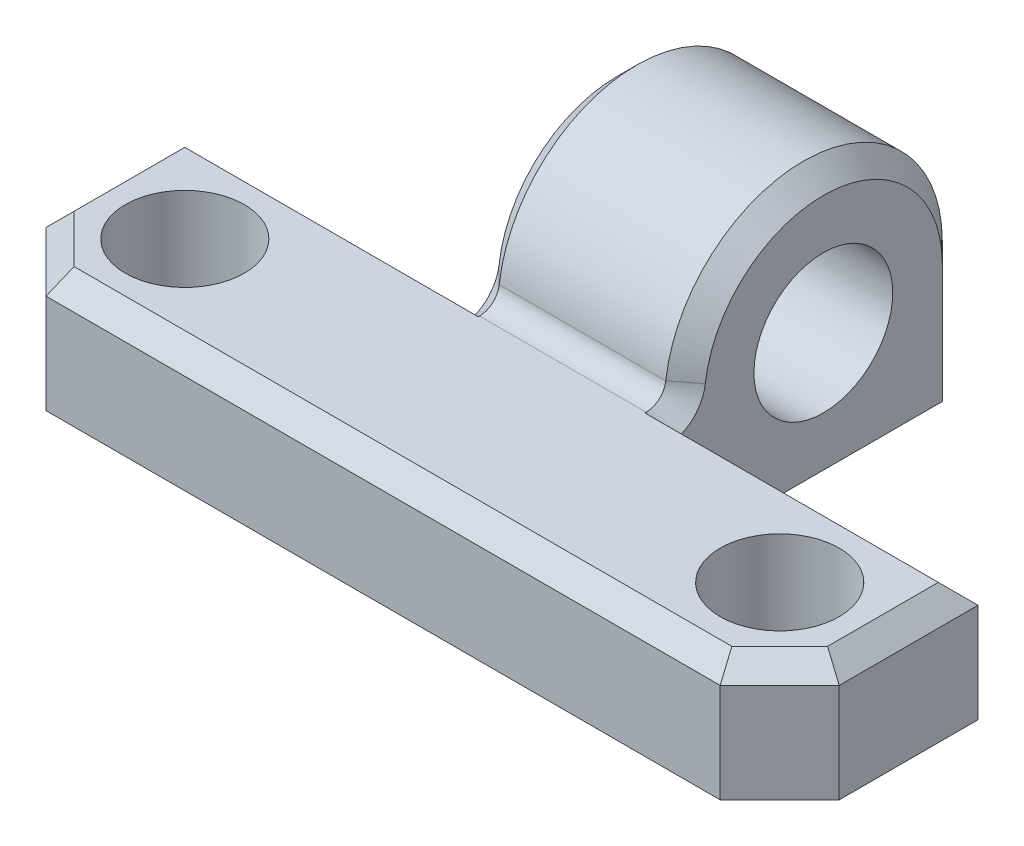
from build123d import *

# Parameters (mm, degrees)
SKIZZE1_W                       = 20
SKIZZE1_H                       = 12
AUFSATZ_LINEAR_AUSTRAGEN1_DEPTH = 3
SCHNITT_LINEAR_AUSTRAGEN1_REACH = 14.042
SKIZZE2_R                       = 1.5
AUFSATZ_LINEAR_AUSTRAGEN2_DEPTH = 20
FASE1_SIZE                      = 1.5
SKIZZE4_R                       = 1.75
SCHNITT_LINEAR_AUSTRAGEN2_DEPTH = 22.868927729
SKIZZE5_W                       = 7.4
SKIZZE5_H                       = 7
SCHNITT_LINEAR_AUSTRAGEN5_DEPTH = 14.351029923
FASE2_SIZE                      = 0.5
VERRUNDUNG1_R                   = 0.5
FASE3_SIZE                      = 0.5


with BuildPart() as part:
    # Skizze1 → Aufsatz-Linear austragen1 (new body)
    with BuildSketch(Plane(origin=(0, 0, 0), x_dir=(1, 0, 0), z_dir=(0, 1, 0))):
        Rectangle(SKIZZE1_W, SKIZZE1_H)
    extrude(amount=AUFSATZ_LINEAR_AUSTRAGEN1_DEPTH)

    # Skizze2 → Schnitt-Linear austragen1 (cut, up to next)
    with BuildSketch(Plane(origin=(0, 3, 0), x_dir=(1, 0, 0), z_dir=(0, 1, 0)), mode=Mode.PRIVATE) as schnitt_linear_austragen1_sk1:
        with Locations(Location((-7.5, -3.5, 0), (0, 0, 270))):
            Circle(SKIZZE2_R)
    schnitt_linear_austragen1_tool1 = extrude(schnitt_linear_austragen1_sk1.sketch, amount=-SCHNITT_LINEAR_AUSTRAGEN1_REACH, mode=Mode.PRIVATE) & part.part
    # Skizze2 → Schnitt-Linear austragen1 (cut, up to next)
    with BuildSketch(Plane(origin=(0, 3, 0), x_dir=(1, 0, 0), z_dir=(0, 1, 0)), mode=Mode.PRIVATE) as schnitt_linear_austragen1_sk2:
        with Locations(Location((7.5, -3.5, 0), (0, 0, 270))):
            Circle(SKIZZE2_R)
    schnitt_linear_austragen1_tool2 = extrude(schnitt_linear_austragen1_sk2.sketch, amount=-SCHNITT_LINEAR_AUSTRAGEN1_REACH, mode=Mode.PRIVATE) & part.part
    add(schnitt_linear_austragen1_tool1.solids().sort_by_distance((-7.5, 3, 3.5))[0], mode=Mode.SUBTRACT)
    add(schnitt_linear_austragen1_tool2.solids().sort_by_distance((7.5, 3, 3.5))[0], mode=Mode.SUBTRACT)

    # Skizze3 → Aufsatz-Linear austragen2 (add)
    with BuildSketch(Plane.ZY.offset(10)):
        with BuildLine():
            Line((-6, 3), (1, 3))
            ThreePointArc((1, 3), (-2.5, 6.5), (-6, 3))
        make_face()
    extrude(amount=-AUFSATZ_LINEAR_AUSTRAGEN2_DEPTH)

    # Fase1
    fase1_edges = [part.edges().sort_by_distance(p)[0] for p in [
        (10, 1.5, 6),
        (-10, 1.5, 6),
    ]]
    chamfer(fase1_edges, length=FASE1_SIZE)

    # Skizze4 → Schnitt-Linear austragen2 (cut, through all)
    with BuildSketch(Plane.ZY.offset(10)):
        with Locations((-2.5, 3)):
            Circle(SKIZZE4_R)
    extrude(amount=-SCHNITT_LINEAR_AUSTRAGEN2_DEPTH, mode=Mode.SUBTRACT)

    # Skizze5 → Schnitt-Linear austragen5 (cut, through all)
    with BuildSketch(Plane(origin=(0, 0, 0), x_dir=(1, 0, 0), z_dir=(0, 1, 0))):
        with Locations((-6.3, 2.5)):
            Rectangle(SKIZZE5_W, SKIZZE5_H)
        with Locations((6.3, 2.5)):
            Rectangle(SKIZZE5_W, SKIZZE5_H)
    extrude(amount=SCHNITT_LINEAR_AUSTRAGEN5_DEPTH, mode=Mode.SUBTRACT)

    # Fase2
    fase2_edges = [part.edges().sort_by_distance(p)[0] for p in [
        (-10, 3, 2.75),
        (6.3, 3, 1),
        (10, 3, 2.75),
        (0, 3, 6),
        (-9.25, 3, 5.25),
        (9.25, 3, 5.25),
        (-6.3, 3, 1),
    ]]
    chamfer(fase2_edges, length=FASE2_SIZE)

    # Verrundung1
    verrundung1_edges = [part.edges().sort_by_distance(p)[0] for p in [
        (0, 3, 1),
    ]]
    fillet(verrundung1_edges, radius=VERRUNDUNG1_R)

    # Fase3
    # the kernel refuses this chamfer: 0.5 mm, written as the material it takes off along each edge
    with BuildSketch(Plane(origin=(2.6, 3, 1.468626967), x_dir=(-0.9996219169112968, 0.027495876610586487, 0), z_dir=(0, 0, 1))) as fase3_piece_1_section:
        Polygon((FASE3_SIZE * 0.999621916911, FASE3_SIZE * 0.0274958766106), (-FASE3_SIZE * 0.0274958766106, FASE3_SIZE * 0.999621916911), (0, 0), align=None)
    fase3_piece_1 = extrude(amount=1.317214527, mode=Mode.PRIVATE)
    fase3_piece_1 = split(fase3_piece_1, bisect_by=Plane(origin=(2.355172989, 2.984397258, 1.484397258), z_dir=(0, 0.7071067811865476, -0.7071067811865476)), keep=Keep.TOP, mode=Mode.PRIVATE)
    add(fase3_piece_1, mode=Mode.SUBTRACT)
    with BuildSketch(Plane(origin=(-2.6, 3, 1.468626967), x_dir=(0.9996219169112968, 0.027495876610586487, 0), z_dir=(0, 0, 1))) as fase3_piece_2_section:
        Polygon((FASE3_SIZE * 0.999621916911, -FASE3_SIZE * 0.0274958766106), (-FASE3_SIZE * 0.0274958766106, -FASE3_SIZE * 0.999621916911), (0, 0), align=None)
    fase3_piece_2 = extrude(amount=1.317214527, mode=Mode.PRIVATE)
    fase3_piece_2 = split(fase3_piece_2, bisect_by=Plane(origin=(-2.355172989, 2.984397258, 1.484397258), z_dir=(0, 0.7071067811865476, -0.7071067811865476)), keep=Keep.TOP, mode=Mode.PRIVATE)
    add(fase3_piece_2, mode=Mode.SUBTRACT)
    with BuildSketch(Plane(origin=(2.6, 3, -2.5), x_dir=(0, 0.125, 0.9921567416492215), z_dir=(0, -0.9921567416492215, 0.125))) as fase3_piece_3:
        Polygon((3.5 - FASE3_SIZE, 0), (3.5, FASE3_SIZE), (3.5, 0), align=None)
    revolve(axis=Axis((2.6, 3, -2.5), (-1, 0, 0)), revolution_arc=172.819244219, mode=Mode.SUBTRACT)
    with BuildSketch(Plane(origin=(-2.6, 3.5, 1.468626967), x_dir=(0, -1, 0), z_dir=(0, 0, 1))) as fase3_piece_4_section:
        Polygon((0.5, FASE3_SIZE), (0.5 + FASE3_SIZE, 0), (0.5, 0), align=None)
    fase3_piece_4 = revolve(axis=Axis((-2.6, 3.5, 1.468626967), (1, 0, 0)), revolution_arc=82.819244219, mode=Mode.PRIVATE)
    fase3_piece_4 = split(fase3_piece_4, bisect_by=Plane(origin=(-2.375928001, 2.853387765, 1.353387765), z_dir=(0, 0.7071067811865476, -0.7071067811865476)), keep=Keep.TOP, mode=Mode.PRIVATE)
    add(fase3_piece_4, mode=Mode.SUBTRACT)
    with BuildSketch(Plane(origin=(2.6, 3.5, 1.468626967), x_dir=(0, -1, 0), z_dir=(0, 0, 1))) as fase3_piece_5_section:
        Polygon((0.5 + FASE3_SIZE, 0), (0.5, -FASE3_SIZE), (0.5, 0), align=None)
    fase3_piece_5 = revolve(axis=Axis((2.6, 3.5, 1.468626967), (1, 0, 0)), revolution_arc=82.819244219, mode=Mode.PRIVATE)
    fase3_piece_5 = split(fase3_piece_5, bisect_by=Plane(origin=(2.437201985, 2.797231412, 1.297231412), z_dir=(0, 0.7071067811865476, -0.7071067811865476)), keep=Keep.TOP, mode=Mode.PRIVATE)
    add(fase3_piece_5, mode=Mode.SUBTRACT)
    with BuildSketch(Plane(origin=(-2.6, 3, -2.5), x_dir=(0, 0.125, 0.9921567416492215), z_dir=(0, -0.9921567416492215, 0.125))) as fase3_piece_6:
        Polygon((3.5 - FASE3_SIZE, 0), (3.5, -FASE3_SIZE), (3.5, 0), align=None)
    revolve(axis=Axis((-2.6, 3, -2.5), (-1, 0, 0)), revolution_arc=172.819244219, mode=Mode.SUBTRACT)
    with BuildSketch(Plane(origin=(-2.6, -1.285841494, -6), x_dir=(-0.02749587661058651, 0, 0.9996219169112968), z_dir=(0, 1, 0))) as fase3_piece_7:
        Polygon((FASE3_SIZE * 0.999621916911, FASE3_SIZE * 0.0274958766106), (-FASE3_SIZE * 0.0274958766106, FASE3_SIZE * 0.999621916911), (0, 0), align=None)
    extrude(amount=4.285841494, mode=Mode.SUBTRACT)
    with BuildSketch(Plane(origin=(2.6, -1.285841494, -6), x_dir=(0.02749587661058651, 0, 0.9996219169112968), z_dir=(0, 1, 0))) as fase3_piece_8:
        Polygon((FASE3_SIZE * 0.999621916911, -FASE3_SIZE * 0.0274958766106), (-FASE3_SIZE * 0.0274958766106, -FASE3_SIZE * 0.999621916911), (0, 0), align=None)
    extrude(amount=4.285841494, mode=Mode.SUBTRACT)


solid = part.part
